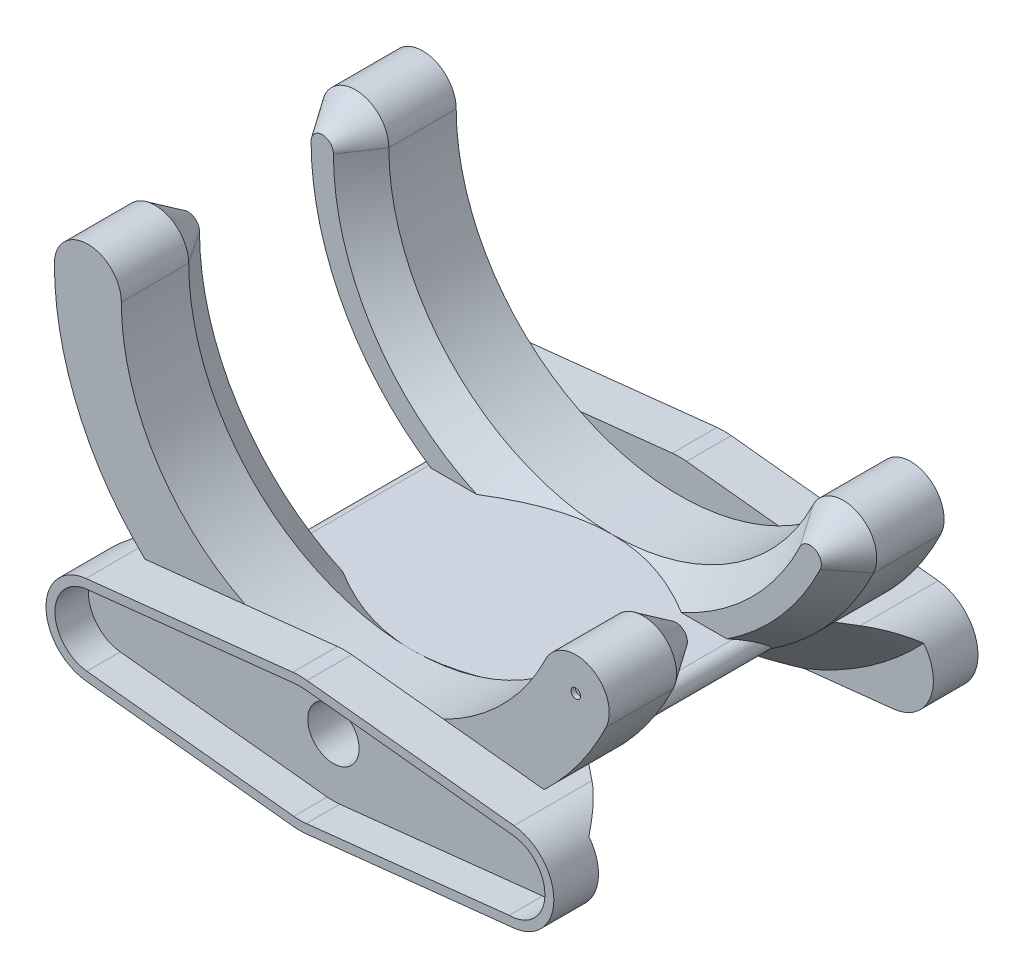
from build123d import *

# Parameters (mm, degrees)
ARM_EXTRUDE_DEPTH        = 38.1
SKETCH2_R                = 0.546252118
GUIDE_HOLE_DEPTH         = 0.508
MID_CUT_DEPTH            = 55.35837378
MID_CUT_DEPTH_BACK       = 55.35837378
SKETCH4_W                = 15.24
SKETCH4_H                = 40.806370212
CHAMFER1_SIZE            = 2.54
CHAMFER1_SIZE_2          = 3.76570486
SERVO_HORN_BASE_DEPTH    = 1.27
SERVO_HORN_EXTRUDE_DEPTH = 3.81
FILLET1_R                = 1.27
CHAMFER2_START           = 33.0199999
CHAMFER2_DEPTH           = 5.0800001
CHAMFER2_3_DEPTH         = 5.0800001
SKETCH7_R                = 2.921
SCREWDRIVER_HOLE_DEPTH   = 57.767721632
CUT_EXTRUDE1_START       = -19.05
SKETCH8_W                = 85.636651201
SKETCH8_H                = 66.005658068
CUT_EXTRUDE1_DEPTH       = 19.05


with BuildPart() as part:
    # Sketch1 → arm extrude (new body)
    with BuildSketch(Plane.XY):
        with BuildLine():
            ThreePointArc((-25.4, 12.7), (-5.664386724, -12.060345778), (22.873600239, 1.656521739))
            ThreePointArc((22.873600239, 1.656521739), (27.961162014, 3.431040036), (29.735680311, -1.656521739))
            ThreePointArc((29.735680311, -1.656521739), (-7.363702742, -19.488449511), (-33.02, 12.7))
            ThreePointArc((-33.02, 12.7), (-29.21, 16.51), (-25.4, 12.7))
        make_face()
    extrude(amount=ARM_EXTRUDE_DEPTH)

    # Sketch2 → guide hole (cut)
    with BuildSketch(Plane.XY.offset(38.1)):
        with Locations((26.304640275, 0)):
            Circle(SKETCH2_R)
    guide_hole = extrude(amount=-GUIDE_HOLE_DEPTH, mode=Mode.SUBTRACT)

    # Mirror1: guide hole across plane
    add(guide_hole.mirror(Plane.XY.offset(19.05)), mode=Mode.SUBTRACT)

    # Sketch4 → mid cut (cut, two sides: drawn at the far end of the back side and taken through both)
    with BuildSketch(Plane(origin=(0, 0, 0), x_dir=(0, 0, -1), z_dir=(1, 0, 0)).offset(-MID_CUT_DEPTH_BACK)):
        with Locations((-19.05, 7.703185106)):
            Rectangle(SKETCH4_W, SKETCH4_H)
    extrude(amount=MID_CUT_DEPTH + MID_CUT_DEPTH_BACK, mode=Mode.SUBTRACT)

    # Chamfer1
    # the kernel refuses this chamfer: 3.76570486, 2.54 mm, written as the material it takes off along each edge
    with BuildSketch(Plane(origin=(0, 12.7, 26.67), x_dir=(0.9005354424873052, -0.43478260869564844, 0), z_dir=(0.43478260869564844, 0.9005354424873052, 0))) as chamfer1_piece_1_section:
        Polygon((25.4 + CHAMFER1_SIZE, 0), (25.4, -CHAMFER1_SIZE_2), (25.4, 0), align=None)
    chamfer1_piece_1 = revolve(axis=Axis((0, 12.7, 26.67), (0, 0, -1)), revolution_arc=64.228538259, mode=Mode.PRIVATE)
    chamfer1_piece_1 = split(chamfer1_piece_1, bisect_by=Plane(origin=(0, -12.7, 26.67), z_dir=(0, 1, 0)), keep=Keep.TOP, mode=Mode.PRIVATE)
    add(chamfer1_piece_1, mode=Mode.SUBTRACT)
    with BuildSketch(Plane(origin=(0, 12.7, 26.67), x_dir=(0.900535442487305, -0.4347826086956487, 0), z_dir=(0.4347826086956487, 0.900535442487305, 0))) as chamfer1_piece_2_section:
        Polygon((33.02, -CHAMFER1_SIZE_2), (33.02 - CHAMFER1_SIZE, 0), (33.02, 0), align=None)
    chamfer1_piece_2 = revolve(axis=Axis((0, 12.7, 26.67), (0, 0, -1)), revolution_arc=41.395045941, mode=Mode.PRIVATE)
    chamfer1_piece_2 = split(chamfer1_piece_2, bisect_by=Plane(origin=(0, -12.7, 26.67), z_dir=(0, 1, 0)), keep=Keep.TOP, mode=Mode.PRIVATE)
    add(chamfer1_piece_2, mode=Mode.SUBTRACT)
    with BuildSketch(Plane(origin=(26.304640275, 0, 26.67), x_dir=(-0.9005354424873053, 0.4347826086956483, 0), z_dir=(-0.4347826086956483, -0.9005354424873053, 0))) as chamfer1_piece_3:
        Polygon((3.81, -CHAMFER1_SIZE_2), (3.81 - CHAMFER1_SIZE, 0), (3.81, 0), align=None)
    revolve(axis=Axis((26.304640275, 0, 26.67), (0, 0, -1)), revolution_arc=180, mode=Mode.SUBTRACT)
    with BuildSketch(Plane(origin=(0, 12.7, 26.67), x_dir=(0, -1, 0), z_dir=(1, 0, 0))) as chamfer1_piece_4_section:
        Polygon((25.4 + CHAMFER1_SIZE, 0), (25.4, -CHAMFER1_SIZE_2), (25.4, 0), align=None)
    chamfer1_piece_4 = revolve(axis=Axis((0, 12.7, 26.67), (0, 0, -1)), revolution_arc=90, mode=Mode.PRIVATE)
    chamfer1_piece_4 = split(chamfer1_piece_4, bisect_by=Plane(origin=(0, -12.7, 26.67), z_dir=(0, 1, 0)), keep=Keep.TOP, mode=Mode.PRIVATE)
    add(chamfer1_piece_4, mode=Mode.SUBTRACT)
    with BuildSketch(Plane(origin=(-29.21, 12.7, 26.67), x_dir=(-1, 0, 0), z_dir=(0, -1, 0))) as chamfer1_piece_5:
        Polygon((3.81 - CHAMFER1_SIZE, 0), (3.81, -CHAMFER1_SIZE_2), (3.81, 0), align=None)
    revolve(axis=Axis((-29.21, 12.7, 26.67), (0, 0, -1)), revolution_arc=180, mode=Mode.SUBTRACT)
    with BuildSketch(Plane(origin=(0, 12.7, 26.67), x_dir=(-0.3880284413542799, -0.9216473993345656, 0), z_dir=(0.9216473993345656, -0.3880284413542799, 0))) as chamfer1_piece_6_section:
        Polygon((33.02, -CHAMFER1_SIZE_2), (33.02 - CHAMFER1_SIZE, 0), (33.02, 0), align=None)
    chamfer1_piece_6 = revolve(axis=Axis((0, 12.7, 26.67), (0, 0, -1)), revolution_arc=67.168121234, mode=Mode.PRIVATE)
    chamfer1_piece_6 = split(chamfer1_piece_6, bisect_by=Plane(origin=(0, -12.7, 26.67), z_dir=(0, 1, 0)), keep=Keep.TOP, mode=Mode.PRIVATE)
    add(chamfer1_piece_6, mode=Mode.SUBTRACT)

    # Sketch5 → servo horn base (add)
    with BuildSketch(Plane.XY.offset(38.1)):
        with BuildLine():
            Line((-24.354366667, -11.45898223), (-0.8128, -8.933473345))
            ThreePointArc((-0.8128, -8.933473345), (0, -8.89), (0.8128, -8.933473345))
            Line((0.8128, -8.933473345), (24.354366667, -11.45898223))
            ThreePointArc((24.354366667, -11.45898223), (28.8925, -16.51), (24.354366667, -21.56101777))
            Line((24.354366667, -21.56101777), (0.8128, -24.086526655))
            ThreePointArc((0.8128, -24.086526655), (0, -24.13), (-0.8128, -24.086526655))
            Line((-0.8128, -24.086526655), (-24.354366667, -21.56101777))
            ThreePointArc((-24.354366667, -21.56101777), (-28.8925, -16.51), (-24.354366667, -11.45898223))
        make_face()
    extrude(amount=SERVO_HORN_BASE_DEPTH)

    # Sketch6 → servo horn extrude (add)
    with BuildSketch(Plane.XY.offset(39.37)):
        with BuildLine():
            Line((24.354366667, -11.45898223), (0.8128, -8.933473345))
            ThreePointArc((0.8128, -8.933473345), (0, -8.89), (-0.8128, -8.933473345))
            Line((-0.8128, -8.933473345), (-24.354366667, -11.45898223))
            ThreePointArc((-24.354366667, -11.45898223), (-28.8925, -16.51), (-24.354366667, -21.56101777))
            Line((-24.354366667, -21.56101777), (-0.8128, -24.086526655))
            ThreePointArc((-0.8128, -24.086526655), (0, -24.13), (0.8128, -24.086526655))
            Line((0.8128, -24.086526655), (24.354366667, -21.56101777))
            ThreePointArc((24.354366667, -21.56101777), (28.8925, -16.51), (24.354366667, -11.45898223))
        make_face()
        with BuildLine():
            Line((-24.245993333, -12.469185784), (-0.704426667, -9.943676899))
            ThreePointArc((-0.704426667, -9.943676899), (0, -9.906), (0.704426667, -9.943676899))
            Line((0.704426667, -9.943676899), (24.245993333, -12.469185784))
            ThreePointArc((24.245993333, -12.469185784), (27.870699414, -16.727056473), (23.8125, -20.574))
            Line((23.8125, -20.574), (0.710977357, -23.075617046))
            ThreePointArc((0.710977357, -23.075617046), (0.003294316, -23.113999178), (-0.704426667, -23.076323101))
            Line((-0.704426667, -23.076323101), (-24.245993333, -20.550814216))
            ThreePointArc((-24.245993333, -20.550814216), (-27.8765, -16.51), (-24.245993333, -12.469185784))
        make_face(mode=Mode.SUBTRACT)
    extrude(amount=SERVO_HORN_EXTRUDE_DEPTH)

    # Fillet1
    fillet1_edges = [part.edges().sort_by_distance(p)[0] for p in [
        (21.098824612, -12.7, 20.93285243),
        (-21.098824612, -12.7, 20.93285243),
    ]]
    fillet(fillet1_edges, radius=FILLET1_R)

    # Chamfer2: read off the stored shape, not the designer's step
    # Chamfer2 outline → Chamfer2 (add)
    with BuildSketch(Plane.XY.offset(CHAMFER2_START)):
        with BuildLine():
            ThreePointArc((-0.8128, -24.086526655), (0, -24.13), (0.8128, -24.086526655))
            Line((0.8128, -24.086526655), (24.354366667, -21.56101777))
            ThreePointArc((24.354366667, -21.56101777), (28.8925, -16.51), (24.354366667, -11.45898223))
            Line((24.354366667, -11.45898223), (22.698375076, -11.28132959))
            ThreePointArc((22.698375076, -11.28132959), (0, -20.32), (-22.698375076, -11.28132959))
            Line((-22.698375076, -11.28132959), (-24.354366667, -11.45898223))
            ThreePointArc((-24.354366667, -11.45898223), (-28.8925, -16.51), (-24.354366667, -21.56101777))
            Line((-24.354366667, -21.56101777), (-0.8128, -24.086526655))
        make_face()
    extrude(amount=CHAMFER2_DEPTH)

    # Chamfer2 2 outline → Chamfer2 2 (revolve, cut)
    with BuildSketch(Plane.XZ.offset(-12.7)):
        Polygon((42.762046953, 38.1), (38.1, 38.1), (33.02, 33.02), (42.762046953, 33.02), align=None)
    revolve(axis=Axis((0, 12.7, 0), (0, 0, 1)), mode=Mode.SUBTRACT)

    # Chamfer2 3 outline → Chamfer2 3 (cut)
    with BuildSketch(Plane.XY.offset(CHAMFER2_START)):
        with BuildLine():
            ThreePointArc((-26.847145977, -20.583981319), (-27.019646628, -20.444099863), (-27.191418467, -20.303324399))
            ThreePointArc((-27.191418467, -20.303324399), (-27.022351133, -20.44741739), (-26.847145977, -20.583981319))
        make_face()
        with BuildLine():
            ThreePointArc((27.191418467, -20.303324399), (27.019646628, -20.444099863), (26.847145977, -20.583981319))
            ThreePointArc((26.847145977, -20.583981319), (27.022351133, -20.44741739), (27.191418467, -20.303324399))
        make_face()
    extrude(amount=CHAMFER2_3_DEPTH, mode=Mode.SUBTRACT)

    # Sketch7 → screwdriver hole (cut, through all)
    with BuildSketch(Plane.XY.offset(39.37)):
        with Locations((0, -16.51)):
            Circle(SKETCH7_R)
    extrude(amount=-SCREWDRIVER_HOLE_DEPTH, mode=Mode.SUBTRACT)

    # Sketch8 → Cut-Extrude1 (cut)
    with BuildSketch(Plane(origin=(0, 0, 0), x_dir=(-1, 0, 0), z_dir=(0, 0, -1)).offset(CUT_EXTRUDE1_START)):
        with Locations((-0.504536569, -0.163627582)):
            Rectangle(SKETCH8_W, SKETCH8_H)
    extrude(amount=CUT_EXTRUDE1_DEPTH, mode=Mode.SUBTRACT)

    # Mirror2: part across plane


with BuildPart() as part_1:
    add(part.part)
    add(part.part.mirror(Plane(origin=(0, 0, 19.05), x_dir=(1, 0, 0), z_dir=(0, 0, -1))))


solid = part_1.part
